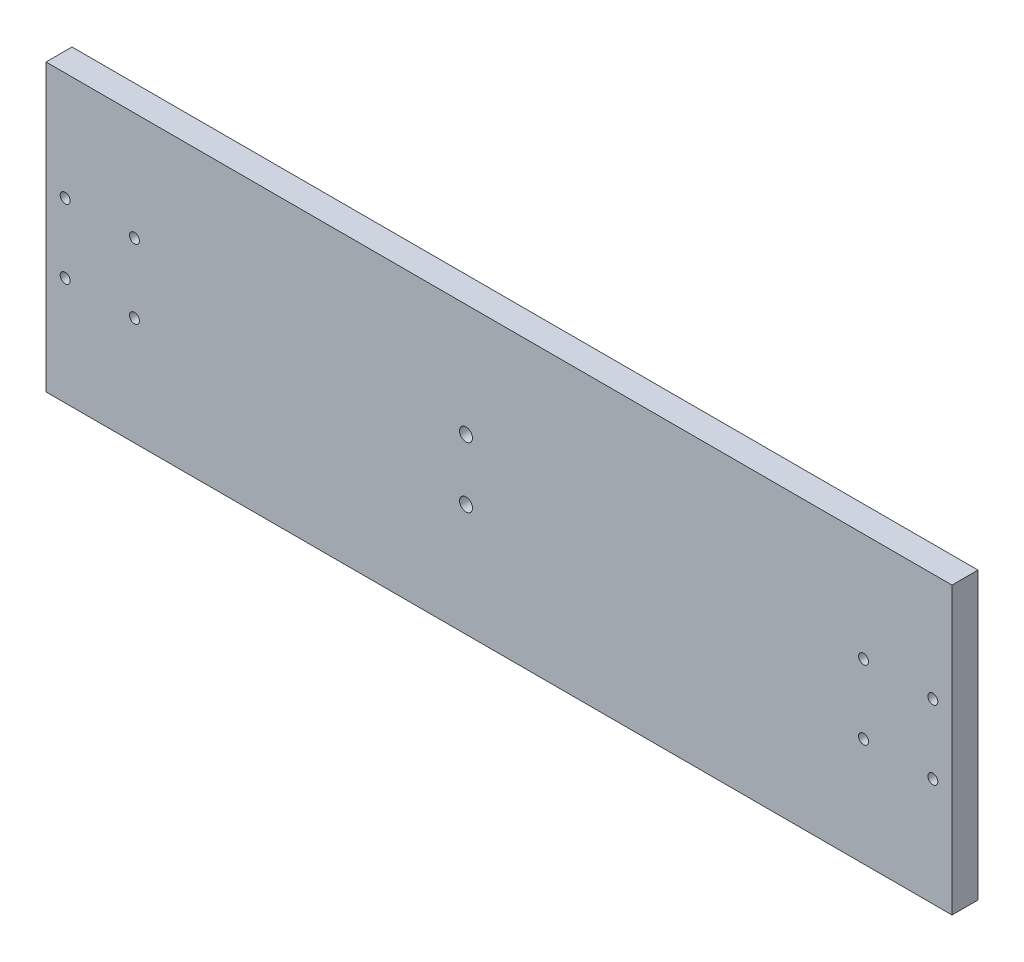
from build123d import *

# Parameters (mm, degrees)
ESQUISSE1_W             = 209.26
ESQUISSE1_H             = 66
BOSS_EXTRU_1_DEPTH      = 6
ESQUISSE2_R             = 1.15
ESQUISSE2_R_2           = 1.5
ENL_V_MAT_EXTRU_1_DEPTH = 6


with BuildPart() as part:
    # Esquisse1 → Boss.-Extru.1 (new body)
    with BuildSketch(Plane.XY):
        Rectangle(ESQUISSE1_W, ESQUISSE1_H)
    extrude(amount=BOSS_EXTRU_1_DEPTH)

    # Esquisse2 → Enlèv. mat.-Extru.1 (cut)
    with BuildSketch(Plane.XY.offset(6)):
        with Locations((-100.2, 8)):
            Circle(ESQUISSE2_R)
        with Locations((-84.2, 8)):
            Circle(ESQUISSE2_R)
        with Locations((-84.2, -8)):
            Circle(ESQUISSE2_R)
        with Locations((-100.2, -8)):
            Circle(ESQUISSE2_R)
        with Locations((100.2, -8)):
            Circle(ESQUISSE2_R)
        with Locations((84.2, -8)):
            Circle(ESQUISSE2_R)
        with Locations((84.2, 8)):
            Circle(ESQUISSE2_R)
        with Locations((100.2, 8)):
            Circle(ESQUISSE2_R)
        with Locations((-7.625, 7)):
            Circle(ESQUISSE2_R_2)
        with Locations((-7.625, -7)):
            Circle(ESQUISSE2_R_2)
    extrude(amount=-ENL_V_MAT_EXTRU_1_DEPTH, mode=Mode.SUBTRACT)


solid = part.part
